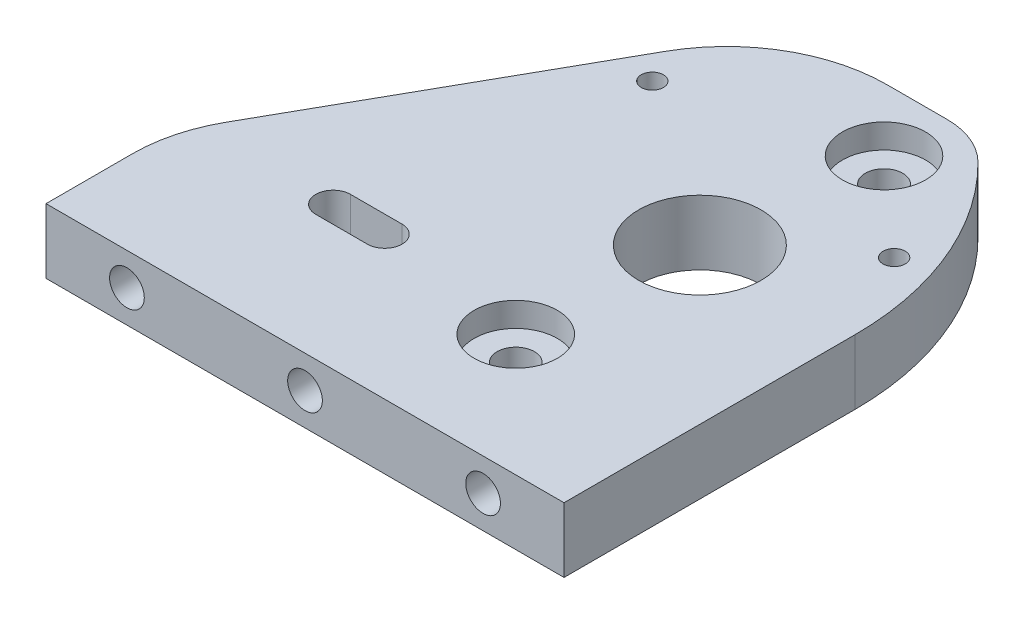
from build123d import *

# Parameters (mm, degrees)
SKETCH1_W                                      = 69.85
SKETCH1_H                                      = 101.6
BOSS_EXTRUDE1_DEPTH                            = 9.525
F_1_4_20_TAPPED_HOLE1_D                        = 5.1054
F_1_4_20_TAPPED_HOLE1_DEPTH                    = 19.05
F_1_4_20_TAPPED_HOLE1_TIP                      = 1.533816902
F_18_0_18_DIAMETER_HOLE1_D                     = 18
CBORE_FOR_M5_HEX_HEAD_BOLT1_D                  = 5.5
CBORE_FOR_M5_HEX_HEAD_BOLT1_CBORE_D            = 12.24
CBORE_FOR_M5_HEX_HEAD_BOLT1_CBORE_DEPTH        = 3.58
CBORE_FOR_4_SOCKET_HEAD_CAP_SCREW1_D           = 3.2639
CBORE_FOR_4_SOCKET_HEAD_CAP_SCREW1_CBORE_D     = 5.55752
CBORE_FOR_4_SOCKET_HEAD_CAP_SCREW1_CBORE_DEPTH = 2.8448
F_10_CLEARANCE_SLOT1_DEPTH                     = 9.525
SKETCH23_W                                     = 3.175
SKETCH23_H                                     = 101.6
BOSS_EXTRUDE2_DEPTH                            = 9.525
CUT_EXTRUDE2_DEPTH                             = 126.482812568


# Read off the part's stored shape, not the designer's step: #10 Clearance Slot1
with BuildPart() as part:
    # Sketch1 → Boss-Extrude1 (new body)
    with BuildSketch(Plane(origin=(0, 0, 0), x_dir=(1, 0, 0), z_dir=(0, 1, 0))):
        with Locations((34.925, 50.8)):
            Rectangle(SKETCH1_W, SKETCH1_H)
    extrude(amount=BOSS_EXTRUDE1_DEPTH)

    # 1/4-20 Tapped Hole1
    with Locations(Plane.XY):
        with Locations((8.73125, 4.7625), (61.11875, 4.7625), (34.925, 4.7625)):
            Hole(F_1_4_20_TAPPED_HOLE1_D / 2, depth=F_1_4_20_TAPPED_HOLE1_DEPTH)
            with Locations((0, 0, -(F_1_4_20_TAPPED_HOLE1_DEPTH + F_1_4_20_TAPPED_HOLE1_TIP / 2))):  # 118° drill point
                Cone(0, F_1_4_20_TAPPED_HOLE1_D / 2, F_1_4_20_TAPPED_HOLE1_TIP, mode=Mode.SUBTRACT)

    # Ø18.0 (18) Diameter Hole1 (through all)
    with Locations(Plane(origin=(0, 9.525, 0), x_dir=(1, 0, 0), z_dir=(0, 1, 0))):
        with Locations((50.200768572, 42.808816902)):
            Hole(F_18_0_18_DIAMETER_HOLE1_D / 2)

    # CBORE for M5 Hex Head Bolt1 (through all)
    with Locations(Plane(origin=(0, 9.525, 0), x_dir=(1, 0, 0), z_dir=(0, 1, 0))):
        with Locations((52.379662144, 67.713684392), (48.021875, 17.903949412)):
            CounterBoreHole(CBORE_FOR_M5_HEX_HEAD_BOLT1_D / 2, CBORE_FOR_M5_HEX_HEAD_BOLT1_CBORE_D / 2, CBORE_FOR_M5_HEX_HEAD_BOLT1_CBORE_DEPTH)

    # CBORE for #4 Socket Head Cap Screw1 (through all)
    with Locations(Plane(origin=(0, 0, 0), x_dir=(-1, 0, 0), z_dir=(0, -1, 0))):
        with Locations((-25.814021811, 60.200257539), (-66.075768572, 55.508816902)):
            CounterBoreHole(CBORE_FOR_4_SOCKET_HEAD_CAP_SCREW1_D / 2, CBORE_FOR_4_SOCKET_HEAD_CAP_SCREW1_CBORE_D / 2, CBORE_FOR_4_SOCKET_HEAD_CAP_SCREW1_CBORE_DEPTH)

    # #10 Clearance Slot1 outline → #10 Clearance Slot1 (cut)
    with BuildSketch(Plane(origin=(0, 0, 0), x_dir=(1, 0, 0), z_dir=(0, 1, 0))):
        with BuildLine():
            Line((18.030825, 18.474656367), (25.625425, 18.474656367))
            ThreePointArc((25.625425, 18.474656367), (28.178125, 21.027356367), (25.625425, 23.580056367))
            Line((25.625425, 23.580056367), (18.030825, 23.580056367))
            ThreePointArc((18.030825, 23.580056367), (15.478125, 21.027356367), (18.030825, 18.474656367))
        make_face()
    extrude(amount=F_10_CLEARANCE_SLOT1_DEPTH, mode=Mode.SUBTRACT)

    # Sketch23 → Boss-Extrude2 (add)
    with BuildSketch(Plane(origin=(0, 0, 0), x_dir=(1, 0, 0), z_dir=(0, 1, 0))):
        with Locations((71.4375, 50.8)):
            Rectangle(SKETCH23_W, SKETCH23_H)
        with Locations((-1.5875, 50.8)):
            Rectangle(SKETCH23_W, SKETCH23_H)
    extrude(amount=BOSS_EXTRUDE2_DEPTH)

    # Sketch24 → Cut-Extrude2 (cut, through all)
    with BuildSketch(Plane(origin=(0, 0, 0), x_dir=(1, 0, 0), z_dir=(0, 1, 0))):
        with BuildLine():
            ThreePointArc((60.086847532, 73.833684392), (69.661188781, 59.594122619), (73.025, 42.768014811))
            Line((73.025, 42.768014811), (73.025, 101.6))
            Line((73.025, 101.6), (-3.175, 101.6))
            Line((-3.175, 101.6), (-3.175, 12.7))
            ThreePointArc((-3.175, 12.7), (-2.45000516, 18.323895492), (-0.322426517, 23.580056367))
            Line((-0.322426517, 23.580056367), (22.97958653, 64.963684392))
            ThreePointArc((22.97958653, 64.963684392), (31.651165616, 73.776549238), (43.584990358, 77.008684392))
            Line((43.584990358, 77.008684392), (52.379662144, 77.008684392))
            ThreePointArc((52.379662144, 77.008684392), (56.547435278, 76.183844834), (60.086847532, 73.833684392))
        make_face()
    extrude(amount=CUT_EXTRUDE2_DEPTH, mode=Mode.SUBTRACT)


solid = part.part
